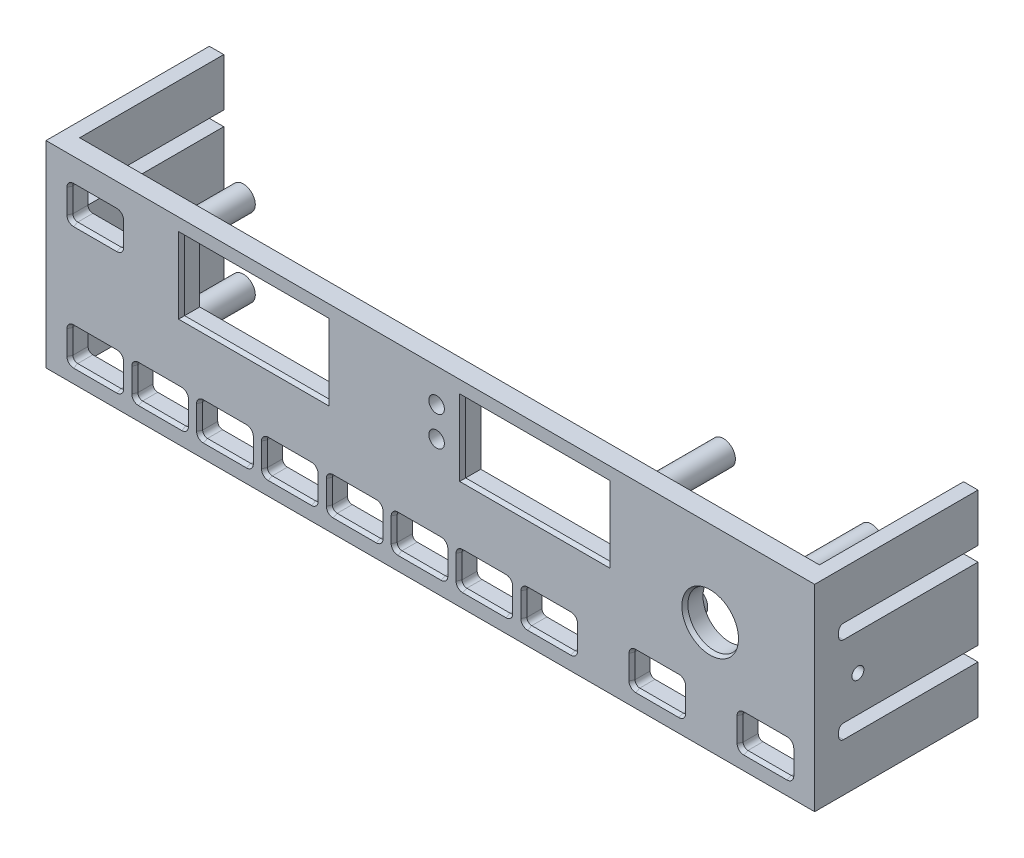
from build123d import *

# Parameters (mm, degrees)
ESQUISSE1_W             = 160
ESQUISSE1_H             = 41
BOSS_EXTRU_1_DEPTH      = 4
ESQUISSE2_R             = 5.5
ESQUISSE2_R_2           = 1.625
ESQUISSE2_W             = 30.5
ESQUISSE2_H             = 15
ENL_V_MAT_EXTRU_1_DEPTH = 4
ESQUISSE4_W             = 3
ESQUISSE4_H             = 41
BOSS_EXTRU_2_DEPTH      = 30
ENL_V_MAT_EXTRU_2_DEPTH = 168.871975029
ESQUISSE7_R             = 2.5
ESQUISSE7_R_2           = 1.25
BOSS_EXTRU_3_DEPTH      = 15
CHANFREIN1_SIZE         = 0.4
CHANFREIN1_SIZE2        = 0.857802768
ESQUISSE9_R             = 1.25
ENL_V_MAT_EXTRU_3_DEPTH = 900


with BuildPart() as part:
    # Esquisse1 → Boss.-Extru.1 (new body)
    with BuildSketch(Plane.XY):
        with Locations((80, 20.5)):
            Rectangle(ESQUISSE1_W, ESQUISSE1_H)
    extrude(amount=BOSS_EXTRU_1_DEPTH)

    # Esquisse2 → Enlèv. mat.-Extru.1 (cut)
    with BuildSketch(Plane.XY.offset(4)):
        with Locations((138.25, 23.25)):
            Circle(ESQUISSE2_R)
        with Locations((81.3, 34.05)):
            Circle(ESQUISSE2_R_2)
        with Locations((81.3, 27.83)):
            Circle(ESQUISSE2_R_2)
        with BuildLine():
            Line((19.25, 10.25), (28.25, 10.25))
            ThreePointArc((28.25, 10.25), (28.957106781, 9.957106781), (29.25, 9.25))
            Line((29.25, 9.25), (29.25, 4.25))
            ThreePointArc((29.25, 4.25), (28.957106781, 3.542893219), (28.25, 3.25))
            Line((28.25, 3.25), (19.25, 3.25))
            ThreePointArc((19.25, 3.25), (18.542893219, 3.542893219), (18.25, 4.25))
            Line((18.25, 4.25), (18.25, 9.25))
            ThreePointArc((18.25, 9.25), (18.542893219, 9.957106781), (19.25, 10.25))
        make_face()
        with BuildLine():
            Line((5.75, 3.25), (14.75, 3.25))
            ThreePointArc((14.75, 3.25), (15.457106781, 3.542893219), (15.75, 4.25))
            Line((15.75, 4.25), (15.75, 9.25))
            ThreePointArc((15.75, 9.25), (15.457106781, 9.957106781), (14.75, 10.25))
            Line((14.75, 10.25), (5.75, 10.25))
            ThreePointArc((5.75, 10.25), (5.042893219, 9.957106781), (4.75, 9.25))
            Line((4.75, 9.25), (4.75, 4.25))
            ThreePointArc((4.75, 4.25), (5.042893219, 3.542893219), (5.75, 3.25))
        make_face()
        with BuildLine():
            Line((32.75, 10.25), (41.75, 10.25))
            ThreePointArc((41.75, 10.25), (42.457106781, 9.957106781), (42.75, 9.25))
            Line((42.75, 9.25), (42.75, 4.25))
            ThreePointArc((42.75, 4.25), (42.457106781, 3.542893219), (41.75, 3.25))
            Line((41.75, 3.25), (32.75, 3.25))
            ThreePointArc((32.75, 3.25), (32.042893219, 3.542893219), (31.75, 4.25))
            Line((31.75, 4.25), (31.75, 9.25))
            ThreePointArc((31.75, 9.25), (32.042893219, 9.957106781), (32.75, 10.25))
        make_face()
        with BuildLine():
            Line((46.25, 10.25), (55.25, 10.25))
            ThreePointArc((55.25, 10.25), (55.957106781, 9.957106781), (56.25, 9.25))
            Line((56.25, 9.25), (56.25, 4.25))
            ThreePointArc((56.25, 4.25), (55.957106781, 3.542893219), (55.25, 3.25))
            Line((55.25, 3.25), (46.25, 3.25))
            ThreePointArc((46.25, 3.25), (45.542893219, 3.542893219), (45.25, 4.25))
            Line((45.25, 4.25), (45.25, 9.25))
            ThreePointArc((45.25, 9.25), (45.542893219, 9.957106781), (46.25, 10.25))
        make_face()
        with BuildLine():
            Line((59.75, 10.25), (68.75, 10.25))
            ThreePointArc((68.75, 10.25), (69.457106781, 9.957106781), (69.75, 9.25))
            Line((69.75, 9.25), (69.75, 4.25))
            ThreePointArc((69.75, 4.25), (69.457106781, 3.542893219), (68.75, 3.25))
            Line((68.75, 3.25), (59.75, 3.25))
            ThreePointArc((59.75, 3.25), (59.042893219, 3.542893219), (58.75, 4.25))
            Line((58.75, 4.25), (58.75, 9.25))
            ThreePointArc((58.75, 9.25), (59.042893219, 9.957106781), (59.75, 10.25))
        make_face()
        with BuildLine():
            Line((73.25, 10.25), (82.25, 10.25))
            ThreePointArc((82.25, 10.25), (82.957106781, 9.957106781), (83.25, 9.25))
            Line((83.25, 9.25), (83.25, 4.25))
            ThreePointArc((83.25, 4.25), (82.957106781, 3.542893219), (82.25, 3.25))
            Line((82.25, 3.25), (73.25, 3.25))
            ThreePointArc((73.25, 3.25), (72.542893219, 3.542893219), (72.25, 4.25))
            Line((72.25, 4.25), (72.25, 9.25))
            ThreePointArc((72.25, 9.25), (72.542893219, 9.957106781), (73.25, 10.25))
        make_face()
        with BuildLine():
            Line((86.75, 10.25), (95.75, 10.25))
            ThreePointArc((95.75, 10.25), (96.457106781, 9.957106781), (96.75, 9.25))
            Line((96.75, 9.25), (96.75, 4.25))
            ThreePointArc((96.75, 4.25), (96.457106781, 3.542893219), (95.75, 3.25))
            Line((95.75, 3.25), (86.75, 3.25))
            ThreePointArc((86.75, 3.25), (86.042893219, 3.542893219), (85.75, 4.25))
            Line((85.75, 4.25), (85.75, 9.25))
            ThreePointArc((85.75, 9.25), (86.042893219, 9.957106781), (86.75, 10.25))
        make_face()
        with BuildLine():
            Line((100.25, 10.25), (109.25, 10.25))
            ThreePointArc((109.25, 10.25), (109.957106781, 9.957106781), (110.25, 9.25))
            Line((110.25, 9.25), (110.25, 4.25))
            ThreePointArc((110.25, 4.25), (109.957106781, 3.542893219), (109.25, 3.25))
            Line((109.25, 3.25), (100.25, 3.25))
            ThreePointArc((100.25, 3.25), (99.542893219, 3.542893219), (99.25, 4.25))
            Line((99.25, 4.25), (99.25, 9.25))
            ThreePointArc((99.25, 9.25), (99.542893219, 9.957106781), (100.25, 10.25))
        make_face()
        with BuildLine():
            Line((122.75, 3.25), (131.75, 3.25))
            ThreePointArc((131.75, 3.25), (132.457106781, 3.542893219), (132.75, 4.25))
            Line((132.75, 4.25), (132.75, 9.25))
            ThreePointArc((132.75, 9.25), (132.457106781, 9.957106781), (131.75, 10.25))
            Line((131.75, 10.25), (122.75, 10.25))
            ThreePointArc((122.75, 10.25), (122.042893219, 9.957106781), (121.75, 9.25))
            Line((121.75, 9.25), (121.75, 4.25))
            ThreePointArc((121.75, 4.25), (122.042893219, 3.542893219), (122.75, 3.25))
        make_face()
        with BuildLine():
            Line((145.25, 3.25), (154.25, 3.25))
            ThreePointArc((154.25, 3.25), (154.957106781, 3.542893219), (155.25, 4.25))
            Line((155.25, 4.25), (155.25, 9.25))
            ThreePointArc((155.25, 9.25), (154.957106781, 9.957106781), (154.25, 10.25))
            Line((154.25, 10.25), (145.25, 10.25))
            ThreePointArc((145.25, 10.25), (144.542893219, 9.957106781), (144.25, 9.25))
            Line((144.25, 9.25), (144.25, 4.25))
            ThreePointArc((144.25, 4.25), (144.542893219, 3.542893219), (145.25, 3.25))
        make_face()
        with BuildLine():
            Line((5.75, 35.75), (14.75, 35.75))
            ThreePointArc((14.75, 35.75), (15.457106781, 35.457106781), (15.75, 34.75))
            Line((15.75, 34.75), (15.75, 29.75))
            ThreePointArc((15.75, 29.75), (15.457106781, 29.042893219), (14.75, 28.75))
            Line((14.75, 28.75), (5.75, 28.75))
            ThreePointArc((5.75, 28.75), (5.042893219, 29.042893219), (4.75, 29.75))
            Line((4.75, 29.75), (4.75, 34.75))
            ThreePointArc((4.75, 34.75), (5.042893219, 35.457106781), (5.75, 35.75))
        make_face()
        with Locations((43.25, 30.5)):
            Rectangle(ESQUISSE2_W, ESQUISSE2_H)
        with Locations((101.75, 30.5)):
            Rectangle(ESQUISSE2_W, ESQUISSE2_H)
    extrude(amount=-ENL_V_MAT_EXTRU_1_DEPTH, mode=Mode.SUBTRACT)

    # Esquisse4 → Boss.-Extru.2 (add)
    with BuildSketch(Plane(origin=(0, 0, 0), x_dir=(-1, 0, 0), z_dir=(0, 0, -1))):
        with Locations((-158.5, 20.5)):
            Rectangle(ESQUISSE4_W, ESQUISSE4_H)
        with Locations((-1.5, 20.5)):
            Rectangle(ESQUISSE4_W, ESQUISSE4_H)
    extrude(amount=BOSS_EXTRU_2_DEPTH)

    # Esquisse5 → Enlèv. mat.-Extru.2 (cut, through all)
    with BuildSketch(Plane(origin=(160, 0, 0), x_dir=(0, 0, -1), z_dir=(1, 0, 0))):
        with BuildLine():
            Line((30, 13), (2, 13))
            ThreePointArc((2, 13), (1.292893219, 12.707106781), (1, 12))
            Line((1, 12), (1, 11))
            ThreePointArc((1, 11), (1.292893219, 10.292893219), (2, 10))
            Line((2, 10), (30, 10))
            Line((30, 10), (30, 13))
        make_face()
        with BuildLine():
            Line((30, 31), (2, 31))
            ThreePointArc((2, 31), (1.292893219, 30.707106781), (1, 30))
            Line((1, 30), (1, 29))
            ThreePointArc((1, 29), (1.292893219, 28.292893219), (2, 28))
            Line((2, 28), (30, 28))
            Line((30, 28), (30, 31))
        make_face()
    extrude(amount=-ENL_V_MAT_EXTRU_2_DEPTH, mode=Mode.SUBTRACT)

    # Esquisse7 → Boss.-Extru.3 (add)
    # profile 1 of 7: a face of its own
    with BuildSketch(Plane(origin=(0, 0, 0), x_dir=(-1, 0, 0), z_dir=(0, 0, -1))):
        with Locations((-22.066417501, 32.220467417)):
            Circle(ESQUISSE7_R)
        with Locations((-22.066417501, 32.220467417)):
            Circle(ESQUISSE7_R_2, mode=Mode.SUBTRACT)
    # profile 2 of 7: a face of its own
    with BuildSketch(Plane(origin=(0, 0, 0), x_dir=(-1, 0, 0), z_dir=(0, 0, -1))):
        with Locations((-22.066417501, 15.960655172)):
            Circle(ESQUISSE7_R)
        with Locations((-22.066417501, 15.960655172)):
            Circle(ESQUISSE7_R_2, mode=Mode.SUBTRACT)
    # profile 3 of 7: a face of its own
    with BuildSketch(Plane(origin=(0, 0, 0), x_dir=(-1, 0, 0), z_dir=(0, 0, -1))):
        with Locations((-152.81245368, 36.297265299)):
            Circle(ESQUISSE7_R)
        with Locations((-152.81245368, 36.297265299)):
            Circle(ESQUISSE7_R_2, mode=Mode.SUBTRACT)
    # profile 4 of 7: a face of its own
    with BuildSketch(Plane(origin=(0, 0, 0), x_dir=(-1, 0, 0), z_dir=(0, 0, -1))):
        with Locations((-152.81245368, 14.495559759)):
            Circle(ESQUISSE7_R)
        with Locations((-152.81245368, 14.495559759)):
            Circle(ESQUISSE7_R_2, mode=Mode.SUBTRACT)
    # profile 5 of 7: a face of its own
    with BuildSketch(Plane(origin=(0, 0, 0), x_dir=(-1, 0, 0), z_dir=(0, 0, -1))):
        with Locations((-122, 36.297265299)):
            Circle(ESQUISSE7_R)
        with Locations((-122, 36.297265299)):
            Circle(ESQUISSE7_R_2, mode=Mode.SUBTRACT)
    # profile 6 of 7: a face of its own
    with BuildSketch(Plane(origin=(0, 0, 0), x_dir=(-1, 0, 0), z_dir=(0, 0, -1))):
        with Locations((-116.25, 6.75)):
            Circle(ESQUISSE7_R)
        with Locations((-116.25, 6.75)):
            Circle(ESQUISSE7_R_2, mode=Mode.SUBTRACT)
    # profile 7 of 7: a face of its own
    with BuildSketch(Plane(origin=(0, 0, 0), x_dir=(-1, 0, 0), z_dir=(0, 0, -1))):
        with Locations((-63.5, 14.495559759)):
            Circle(ESQUISSE7_R)
        with Locations((-63.5, 14.495559759)):
            Circle(ESQUISSE7_R_2, mode=Mode.SUBTRACT)
    extrude(amount=BOSS_EXTRU_3_DEPTH)

    # Chanfrein1
    chanfrein1_edges = [part.edges().sort_by_distance(p)[0] for p in [
        (101.75, 38, 4),
        (117, 30.5, 4),
        (101.75, 23, 4),
        (86.5, 30.5, 4),
        (58.5, 30.5, 4),
        (43.25, 23, 4),
        (28, 30.5, 4),
        (43.25, 38, 4),
        (132.75, 23.25, 4),
        (149.75, 3.25, 4),
        (154.957106781, 3.542893219, 4),
        (144.542893219, 3.542893219, 4),
        (155.25, 6.75, 4),
        (144.25, 6.75, 4),
        (154.957106781, 9.957106781, 4),
        (144.542893219, 9.957106781, 4),
        (149.75, 10.25, 4),
        (127.25, 3.25, 4),
        (132.457106781, 3.542893219, 4),
        (122.042893219, 3.542893219, 4),
        (132.75, 6.75, 4),
        (121.75, 6.75, 4),
        (132.457106781, 9.957106781, 4),
        (122.042893219, 9.957106781, 4),
        (127.25, 10.25, 4),
        (104.75, 3.25, 4),
        (109.957106781, 3.542893219, 4),
        (99.542893219, 3.542893219, 4),
        (110.25, 6.75, 4),
        (99.25, 6.75, 4),
        (109.957106781, 9.957106781, 4),
        (99.542893219, 9.957106781, 4),
        (104.75, 10.25, 4),
        (91.25, 3.25, 4),
        (96.457106781, 3.542893219, 4),
        (86.042893219, 3.542893219, 4),
        (96.75, 6.75, 4),
        (85.75, 6.75, 4),
        (96.457106781, 9.957106781, 4),
        (86.042893219, 9.957106781, 4),
        (91.25, 10.25, 4),
        (77.75, 3.25, 4),
        (82.957106781, 3.542893219, 4),
        (72.542893219, 3.542893219, 4),
        (83.25, 6.75, 4),
        (72.25, 6.75, 4),
        (82.957106781, 9.957106781, 4),
        (72.542893219, 9.957106781, 4),
        (77.75, 10.25, 4),
        (64.25, 3.25, 4),
        (69.457106781, 3.542893219, 4),
        (59.042893219, 3.542893219, 4),
        (69.75, 6.75, 4),
        (58.75, 6.75, 4),
        (69.457106781, 9.957106781, 4),
        (59.042893219, 9.957106781, 4),
        (64.25, 10.25, 4),
        (50.75, 3.25, 4),
        (55.957106781, 3.542893219, 4),
        (45.542893219, 3.542893219, 4),
        (56.25, 6.75, 4),
        (45.25, 6.75, 4),
        (55.957106781, 9.957106781, 4),
        (45.542893219, 9.957106781, 4),
        (50.75, 10.25, 4),
        (37.25, 3.25, 4),
        (42.457106781, 3.542893219, 4),
        (32.042893219, 3.542893219, 4),
        (42.75, 6.75, 4),
        (31.75, 6.75, 4),
        (42.457106781, 9.957106781, 4),
        (32.042893219, 9.957106781, 4),
        (37.25, 10.25, 4),
        (23.75, 3.25, 4),
        (28.957106781, 3.542893219, 4),
        (18.542893219, 3.542893219, 4),
        (29.25, 6.75, 4),
        (18.25, 6.75, 4),
        (28.957106781, 9.957106781, 4),
        (18.542893219, 9.957106781, 4),
        (23.75, 10.25, 4),
        (10.25, 3.25, 4),
        (15.457106781, 3.542893219, 4),
        (5.042893219, 3.542893219, 4),
        (15.75, 6.75, 4),
        (4.75, 6.75, 4),
        (15.457106781, 9.957106781, 4),
        (5.042893219, 9.957106781, 4),
        (10.25, 10.25, 4),
        (10.25, 35.75, 4),
        (5.042893219, 35.457106781, 4),
        (15.457106781, 35.457106781, 4),
        (4.75, 32.25, 4),
        (15.75, 32.25, 4),
        (5.042893219, 29.042893219, 4),
        (15.457106781, 29.042893219, 4),
        (10.25, 28.75, 4),
    ]]
    chanfrein1_side = [part.faces().sort_by_distance(p)[0] for p in [
        (82.430470131, 20.497923343, 4),
    ]]
    chamfer(chanfrein1_edges, length=CHANFREIN1_SIZE, length2=CHANFREIN1_SIZE2, reference=chanfrein1_side[0])

    # Esquisse9 → Enlèv. mat.-Extru.3 (cut)
    with BuildSketch(Plane(origin=(160, 0, 0), x_dir=(0, 0, -1), z_dir=(1, 0, 0))):
        with Locations((5, 20.5)):
            Circle(ESQUISSE9_R)
    extrude(amount=-ENL_V_MAT_EXTRU_3_DEPTH, mode=Mode.SUBTRACT)


solid = part.part
